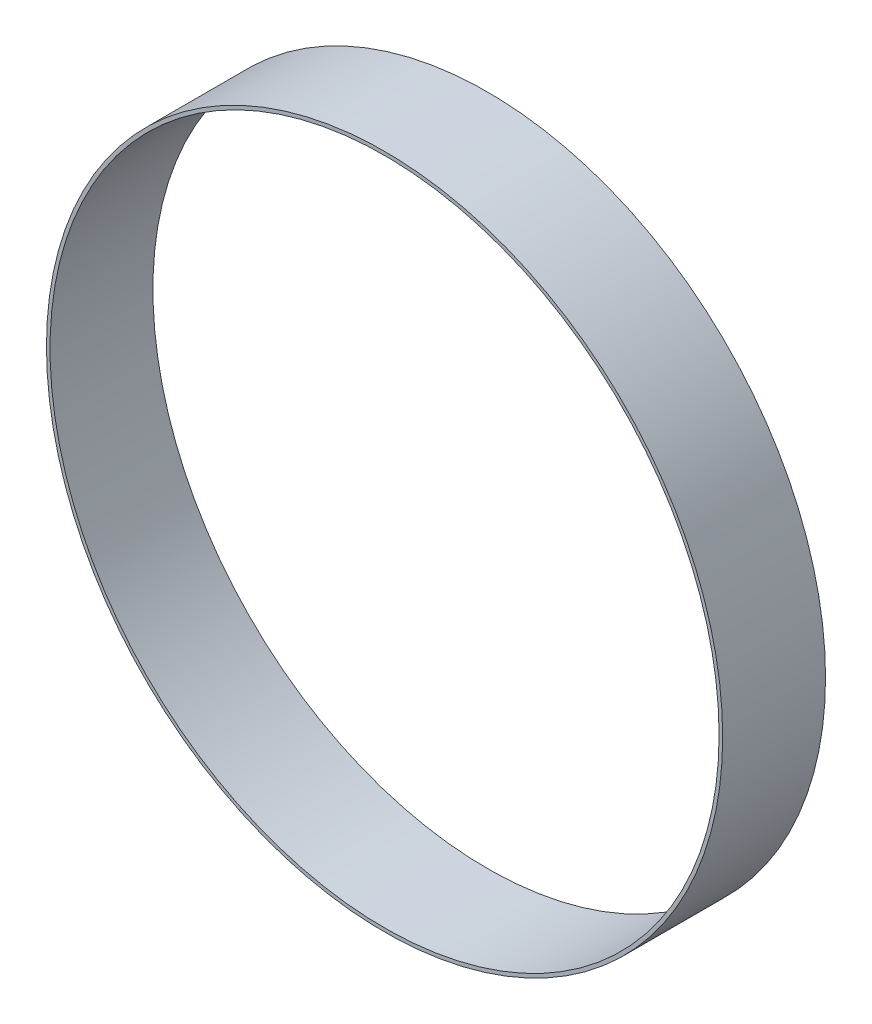
from build123d import *

# Parameters (mm, degrees)
ESQUISSE1_R        = 37.8
ESQUISSE1_R_2      = 37.4
BOSS_EXTRU_1_DEPTH = 11.5


with BuildPart() as part:
    # Esquisse1 → Boss.-Extru.1 (new body)
    with BuildSketch(Plane.XY):
        Circle(ESQUISSE1_R)
        Circle(ESQUISSE1_R_2, mode=Mode.SUBTRACT)
    extrude(amount=BOSS_EXTRU_1_DEPTH)


solid = part.part
